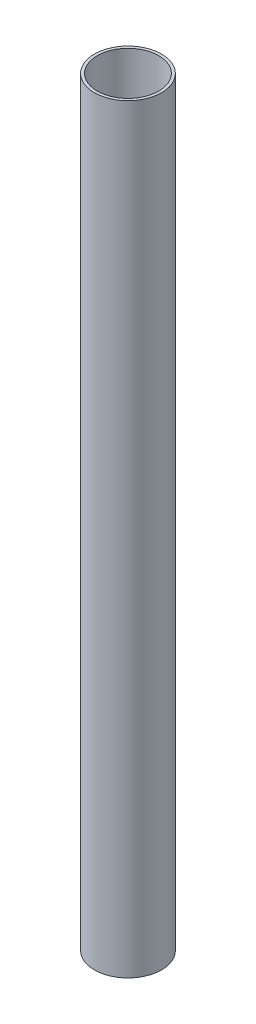
from build123d import *

# Parameters (mm, degrees)
SKETCH2_R           = 19.05
SKETCH2_R_2         = 17.4625
BOSS_EXTRUDE1_DEPTH = 431.8


with BuildPart() as part:
    # Sketch2 → Boss-Extrude1 (new body)
    with BuildSketch(Plane(origin=(0, 0, 0), x_dir=(1, 0, 0), z_dir=(0, 1, 0))):
        Circle(SKETCH2_R)
        Circle(SKETCH2_R_2, mode=Mode.SUBTRACT)
    extrude(amount=BOSS_EXTRUDE1_DEPTH)


solid = part.part
